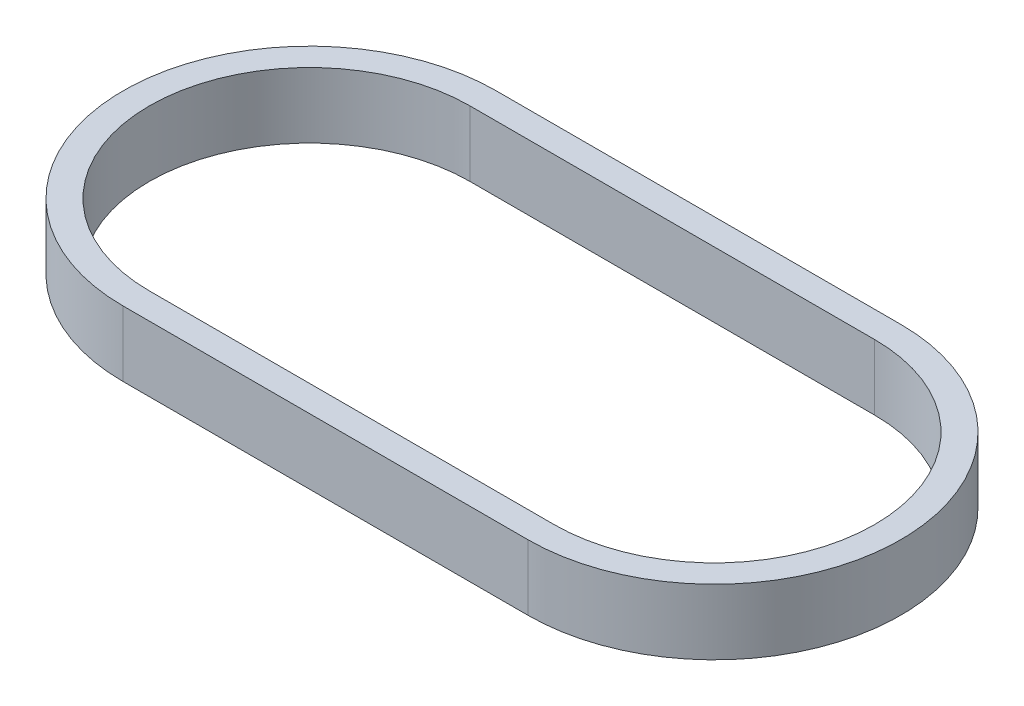
from build123d import *

# Parameters (mm, degrees)
BOSS_EXTRUDE1_DEPTH = 12.7


with BuildPart() as part:
    # Sketch1 → Boss-Extrude1 (new body)
    with BuildSketch(Plane(origin=(0, 0, 0), x_dir=(1, 0, 0), z_dir=(0, 1, 0))):
        with BuildLine():
            Line((0, 36.172139917), (78.520748052, 36.172139917))
            ThreePointArc((78.520748052, 36.172139917), (114.692888052, 8.3e-08), (78.520748052, -36.172139917))
            Line((78.520748052, -36.172139917), (0, -36.172139917))
            ThreePointArc((0, -36.172139917), (-36.172139917, 0), (0, 36.172139917))
        make_face()
        with BuildLine():
            Line((0, 31.092139917), (78.520748052, 31.092139917))
            ThreePointArc((78.520748052, 31.092139917), (109.612888052, 8.3e-08), (78.520748052, -31.092139917))
            Line((78.520748052, -31.092139917), (0, -31.092139917))
            ThreePointArc((0, -31.092139917), (-31.092139917, 0), (0, 31.092139917))
        make_face(mode=Mode.SUBTRACT)
    extrude(amount=BOSS_EXTRUDE1_DEPTH)


solid = part.part
